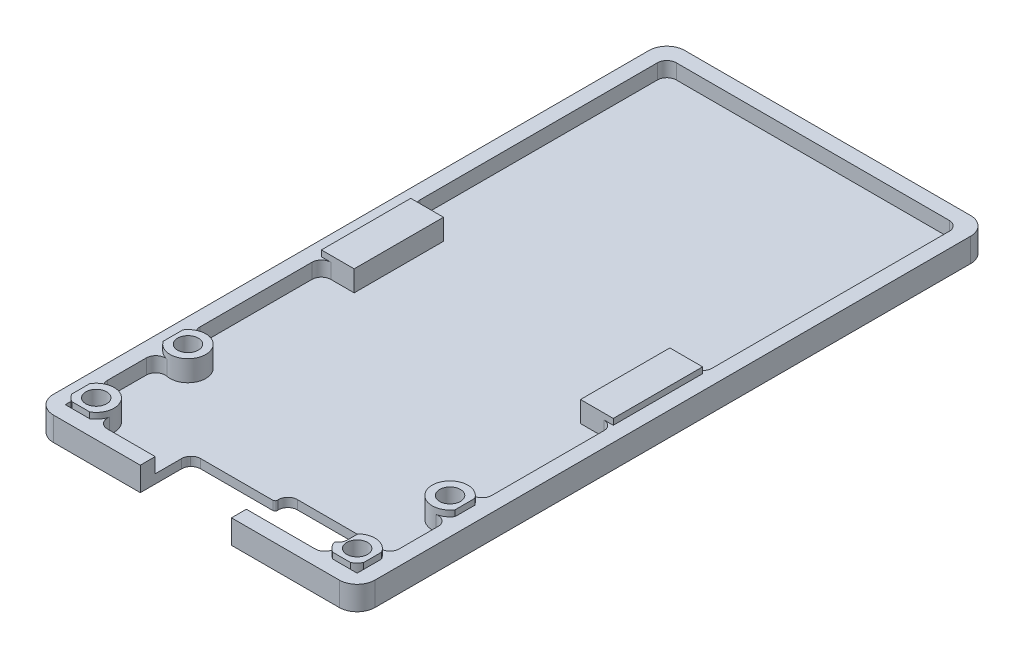
from build123d import *

# Parameters (mm, degrees)
SKETCH1_W           = 49
SKETCH1_H           = 101
BOSS_EXTRUDE1_DEPTH = 1.5
SKETCH2_W           = 54
SKETCH2_H           = 106
SKETCH2_W_2         = 49
SKETCH2_H_2         = 101
BOSS_EXTRUDE2_DEPTH = 4
SKETCH3_W           = 5.5
SKETCH3_H           = 15
BOSS_EXTRUDE3_DEPTH = 5
SKETCH4_R           = 1.75
CUT_EXTRUDE1_DEPTH  = 4.25
SKETCH5_R           = 1.75
CUT_EXTRUDE2_DEPTH  = 4.25
SKETCH6_W           = 14.5
SKETCH6_H           = 7.3
CUT_EXTRUDE3_DEPTH  = 60.690870324
SKETCH7_W           = 13.8
SKETCH7_H           = 6
CUT_EXTRUDE4_DEPTH  = 60.690870324
FILLET1_R           = 3
CUT_EXTRUDE5_DEPTH  = 60.690870324
FILLET2_R           = 1.5875


with BuildPart() as part:
    # Sketch1 → Boss-Extrude1 (new body)
    with BuildSketch(Plane(origin=(0, 0, 0), x_dir=(1, 0, 0), z_dir=(0, 1, 0))):
        Rectangle(SKETCH1_W, SKETCH1_H)
    extrude(amount=BOSS_EXTRUDE1_DEPTH)

    # Sketch2 → Boss-Extrude2 (add)
    with BuildSketch(Plane(origin=(0, 0, 0), x_dir=(1, 0, 0), z_dir=(0, 1, 0))):
        Rectangle(SKETCH2_W, SKETCH2_H)
        Rectangle(SKETCH2_W_2, SKETCH2_H_2, mode=Mode.SUBTRACT)
    extrude(amount=BOSS_EXTRUDE2_DEPTH)

    # Sketch3 → Boss-Extrude3 (add)
    with BuildSketch(Plane(origin=(0, 0, 0), x_dir=(1, 0, 0), z_dir=(0, 1, 0))):
        with BuildLine():
            Line((-24.5, -30.741687605), (-24.5, -34.058312395))
            ThreePointArc((-24.5, -34.058312395), (-19, -32.4), (-24.5, -30.741687605))
        make_face()
        with Locations((-21.75, 0)):
            Rectangle(SKETCH3_W, SKETCH3_H)
        with BuildLine():
            Line((-24.5, -46.403337045), (-24.5, -49.396662955))
            ThreePointArc((-24.5, -49.396662955), (-24.021320344, -50.021320344), (-23.396662955, -50.5))
            Line((-23.396662955, -50.5), (-20.403337045, -50.5))
            ThreePointArc((-20.403337045, -50.5), (-19.778679656, -45.778679656), (-24.5, -46.403337045))
        make_face()
    boss_extrude3 = extrude(amount=BOSS_EXTRUDE3_DEPTH)

    # Mirror1: Boss-Extrude3 across plane
    add(boss_extrude3.mirror(Plane(origin=(0, 0, 0), x_dir=(0, 0, 1), z_dir=(1, 0, 0))))

    # Sketch4 → Cut-Extrude1 (cut)
    with BuildSketch(Plane(origin=(0, 5, 0), x_dir=(1, 0, 0), z_dir=(0, 1, 0))):
        with Locations(Location((-21.9, -47.9, 0), (0, 0, 270))):
            Circle(SKETCH4_R)
        with Locations(Location((21.9, -47.9, 0), (0, 0, 270))):
            Circle(SKETCH4_R)
    extrude(amount=-CUT_EXTRUDE1_DEPTH, mode=Mode.SUBTRACT)

    # Sketch5 → Cut-Extrude2 (cut)
    with BuildSketch(Plane(origin=(0, 5, 0), x_dir=(1, 0, 0), z_dir=(0, 1, 0))):
        with Locations(Location((-22, -32.4, 0), (0, 0, 270))):
            Circle(SKETCH5_R)
        with Locations(Location((22, -32.4, 0), (0, 0, 270))):
            Circle(SKETCH5_R)
    extrude(amount=-CUT_EXTRUDE2_DEPTH, mode=Mode.SUBTRACT)

    # Sketch6 → Cut-Extrude3 (cut, through all)
    with BuildSketch(Plane(origin=(0, 0, 0), x_dir=(1, 0, 0), z_dir=(0, 1, 0))):
        with Locations((-1.75, -48.65)):
            Rectangle(SKETCH6_W, SKETCH6_H)
    extrude(amount=CUT_EXTRUDE3_DEPTH, mode=Mode.SUBTRACT)

    # Sketch7 → Cut-Extrude4 (cut, through all)
    with BuildSketch(Plane(origin=(0, 0, 0), x_dir=(1, 0, 0), z_dir=(0, 1, 0))):
        with Locations((12.4, -45.7)):
            Rectangle(SKETCH7_W, SKETCH7_H)
    extrude(amount=CUT_EXTRUDE4_DEPTH, mode=Mode.SUBTRACT)

    # Fillet1
    fillet1_edges = [part.edges().sort_by_distance(p)[0] for p in [
        (-27, 2, 53),
        (27, 2, 53),
        (27, 2, -53),
        (-27, 2, -53),
    ]]
    fillet(fillet1_edges, radius=FILLET1_R)

    # Sketch9 → Cut-Extrude5 (cut, through all)
    with BuildSketch(Plane(origin=(0, 0, 0), x_dir=(1, 0, 0), z_dir=(0, 1, 0))):
        with BuildLine():
            Line((-7.814445172, -44.472009202), (4.314445172, -44.472009202))
            ThreePointArc((4.314445172, -44.472009202), (4.582924338, -44.36080149), (4.69413205, -44.092322323))
            Line((4.69413205, -44.092322323), (4.69413205, -43.905796609))
            ThreePointArc((4.69413205, -43.905796609), (5.159832268, -42.781496827), (6.28413205, -42.315796609))
            Line((6.28413205, -42.315796609), (18.263585731, -42.315796609))
            ThreePointArc((18.263585731, -42.315796609), (19.387885513, -42.781496827), (19.853585731, -43.905796609))
            Line((19.853585731, -43.905796609), (19.853585731, -47.487814705))
            ThreePointArc((19.853585731, -47.487814705), (19.387885513, -48.612114487), (18.263585731, -49.077814705))
            Line((18.263585731, -49.077814705), (7.489445172, -49.077814705))
            ThreePointArc((7.489445172, -49.077814705), (6.366913156, -49.54278269), (5.901945172, -50.665314705))
            Line((5.901945172, -50.665314705), (5.901945172, -53))
            Line((5.901945172, -53), (-9.401945172, -53))
            Line((-9.401945172, -53), (-9.401945172, -46.059509202))
            ThreePointArc((-9.401945172, -46.059509202), (-8.936977187, -44.936977187), (-7.814445172, -44.472009202))
        make_face()
    extrude(amount=CUT_EXTRUDE5_DEPTH, mode=Mode.SUBTRACT)

    # Fillet2
    # the kernel refuses this fillet: 1.5875 mm, written as the material it adds along each edge
    with BuildSketch(Plane(origin=(20.403337045, 1.5, 50.5), x_dir=(-0.6349026308265473, 0, -0.7725921623790454), z_dir=(0, 1, 0))) as fillet2_piece_1:
        with BuildLine():
            CenterArc((3.087304614, 1.256456201), FILLET2_R, 140.587236848, 91.735718276)
            Line((1.860814556, 2.264364128), (0, 0))
            ThreePointArc((0, 0), (1.058504375, 0.192943091), (2.11700875, 0))
        make_face()
    extrude(amount=2.5)
    with BuildSketch(Plane(origin=(24.5, 1.5, 46.403337045), x_dir=(-0.8047683960868028, 0, -0.5935889391320183), z_dir=(0, 1, 0))) as fillet2_piece_2:
        with BuildLine():
            CenterArc((3.045104664, -1.45404326), FILLET2_R, 113.661459125, 102.750646884)
            Line((1.767534835, -2.396365701), (0, 0))
            ThreePointArc((0, 0), (1.203995254, -0.252201713), (2.407990509, 0))
        make_face()
    extrude(amount=2.5)
    with BuildSketch(Plane(origin=(24.5, 1.5, 34.058312395), x_dir=(-0.8294476443903582, 0, 0.5585844656050558), z_dir=(0, 1, 0)), Plane(origin=(-24.5, 1.5, 30.741687605), x_dir=(0.8294476443903578, 0, -0.5585844656050566), z_dir=(0, 1, 0))) as fillet2_piece_3:
        with BuildLine():
            CenterArc((2.901742174, 1.466820617), FILLET2_R, 146.042039471, 101.473230821)
            Line((1.584994038, 2.353573457), (0, 0))
            ThreePointArc((0, 0), (1.147311568, 0.228055526), (2.294623136, 0))
        make_face()
    extrude(amount=2.5)
    with BuildSketch(Plane(origin=(24.5, 1.5, 30.741687605), x_dir=(-0.8294476443903573, 0, -0.5585844656050574), z_dir=(0, 1, 0)), Plane(origin=(-24.5, 1.5, 34.058312395), x_dir=(0.8294476443903588, 0, 0.5585844656050553), z_dir=(0, 1, 0))) as fillet2_piece_4:
        with BuildLine():
            CenterArc((2.901742174, -1.466820617), FILLET2_R, 112.484729709, 101.473230821)
            Line((1.584994038, -2.353573457), (0, 0))
            ThreePointArc((0, 0), (1.147311568, -0.228055526), (2.294623136, 0))
        make_face()
    extrude(amount=2.5)
    with BuildSketch(Plane(origin=(24.5, 1.5, -7.5), x_dir=(-1, 0, 0), z_dir=(0, 1, 0)), Plane(origin=(-24.5, 1.5, 7.5), x_dir=(1, 0, 0), z_dir=(0, 1, 0))) as fillet2_piece_5:
        with BuildLine():
            CenterArc((FILLET2_R, -FILLET2_R), FILLET2_R, 90, 90)
            Line((0, -FILLET2_R), (0, 0))
            Line((0, 0), (FILLET2_R, 0))
        make_face()
    extrude(amount=2.5)
    with BuildSketch(Plane(origin=(24.5, 1.5, 7.5), x_dir=(-1, 0, 0), z_dir=(0, 1, 0)), Plane(origin=(24.5, 1.5, -50.5), x_dir=(-1, 0, 0), z_dir=(0, 1, 0)), Plane(origin=(-24.5, 1.5, -50.5), x_dir=(0, 0, 1), z_dir=(0, 1, 0)), Plane(origin=(-24.5, 1.5, -7.5), x_dir=(1, 0, 0), z_dir=(0, 1, 0))) as fillet2_piece_6:
        with BuildLine():
            CenterArc((FILLET2_R, FILLET2_R), FILLET2_R, 180, 90)
            Line((0, FILLET2_R), (0, 0))
            Line((0, 0), (FILLET2_R, 0))
        make_face()
    extrude(amount=2.5)
    with BuildSketch(Plane(origin=(-20.403337045, 1.5, 50.5), x_dir=(1, 0, 0), z_dir=(0, 1, 0))) as fillet2_piece_7:
        with BuildLine():
            CenterArc((2.97770851, 1.5875), FILLET2_R, 167.249353116, 102.750646884)
            ThreePointArc((1.429356531, 1.937874659), (0.917642234, 0.819233183), (0, 0))
            Line((0, 0), (2.97770851, 0))
        make_face()
    extrude(amount=2.5)
    with BuildSketch(Plane(origin=(-24.5, 1.5, 46.403337045), x_dir=(0.8047683960868005, 0, -0.5935889391320214), z_dir=(0, 1, 0))) as fillet2_piece_8:
        with BuildLine():
            CenterArc((3.045104664, 1.45404326), FILLET2_R, 143.587893991, 102.750646884)
            Line((1.767534835, 2.396365701), (0, 0))
            ThreePointArc((0, 0), (1.203995254, 0.252201713), (2.407990509, 0))
        make_face()
    extrude(amount=2.5)


solid = part.part
